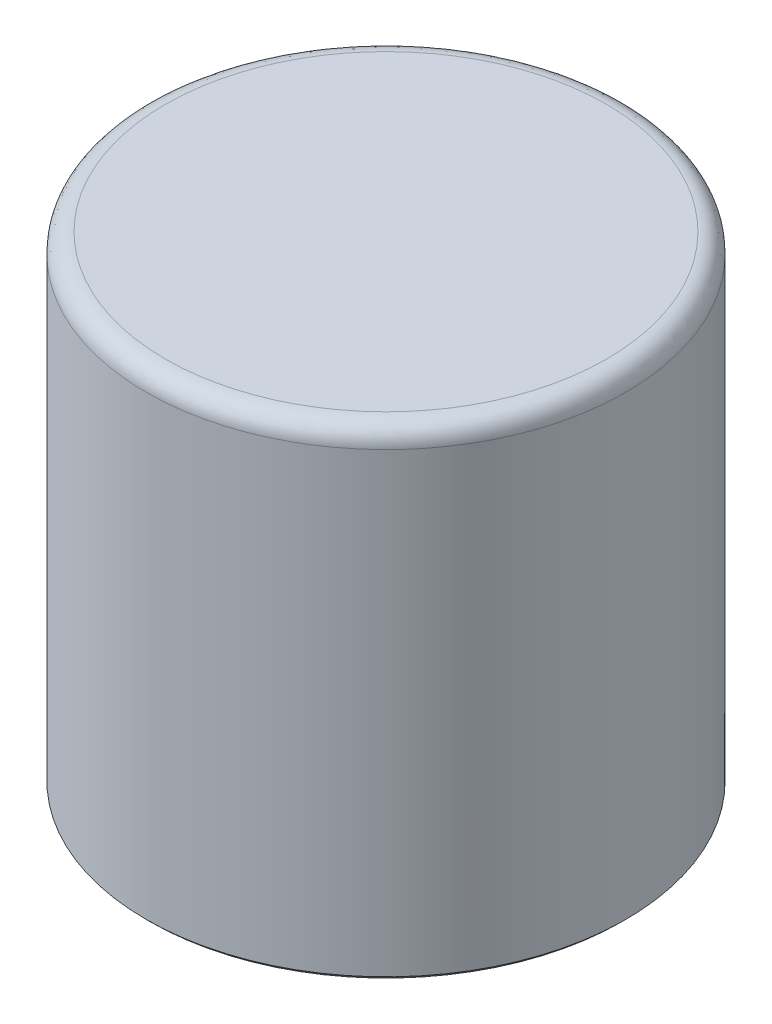
from build123d import *

# Parameters (mm, degrees)
SKETCH_1_R          = 12.5
EXTRUDE_1_DEPTH     = 25
SKETCH_2_R          = 10
CUT_EXTRUDE_1_DEPTH = 5
SKETCH_3_R          = 3
CUT_EXTRUDE_2_DEPTH = 15
CHAMFER_1_SIZE      = 0.2
FILLET_1_SIZE       = 1


with BuildPart() as part:
    # 草图1 → 凸台-拉伸1 (new body)
    with BuildSketch(Plane(origin=(0, 0, 0), x_dir=(1, 0, 0), z_dir=(0, 1, 0))):
        with Locations(Location((0, 0, 0), (0, 0, 270))):
            Circle(SKETCH_1_R)
    extrude(amount=EXTRUDE_1_DEPTH)

    # 草图2 → 切除-拉伸1 (cut)
    with BuildSketch(Plane.XZ):
        with Locations(Location((0, 0, 0), (0, 0, 270))):
            Circle(SKETCH_2_R)
    extrude(amount=-CUT_EXTRUDE_1_DEPTH, mode=Mode.SUBTRACT)

    # 草图3 → 切除-拉伸2 (cut)
    with BuildSketch(Plane.XZ.offset(-5)):
        with Locations(Location((0, 0, 0), (0, 0, 270))):
            Circle(SKETCH_3_R)
    extrude(amount=-CUT_EXTRUDE_2_DEPTH, mode=Mode.SUBTRACT)

    # 倒角1
    chamfer_1_edges = [part.edges().sort_by_distance(p)[0] for p in [
        (0, 5, 3),
        (0, 0, -12.5),
        (0, 0, 10),
    ]]
    chamfer(chamfer_1_edges, length=CHAMFER_1_SIZE)

    # 圆角1
    # a fillet whose section is not a circle: 1 mm, written as the material it takes off along each edge
    with BuildSketch(Plane(origin=(0, 25, 0), x_dir=(0, 0, 1), z_dir=(-1, 0, 0))) as fillet_1_piece_1:
        with BuildLine():
            Bezier((12.5, -FILLET_1_SIZE), (12.5, 0), (12.5 - FILLET_1_SIZE, 0), weights=[1, 0.818181818, 1])
            Line((12.5 - FILLET_1_SIZE, 0), (12.5, 0))
            Line((12.5, 0), (12.5, -FILLET_1_SIZE))
        make_face()
    revolve(axis=Axis((0, 25, 0), (0, 1, 0)), mode=Mode.SUBTRACT)


solid = part.part
